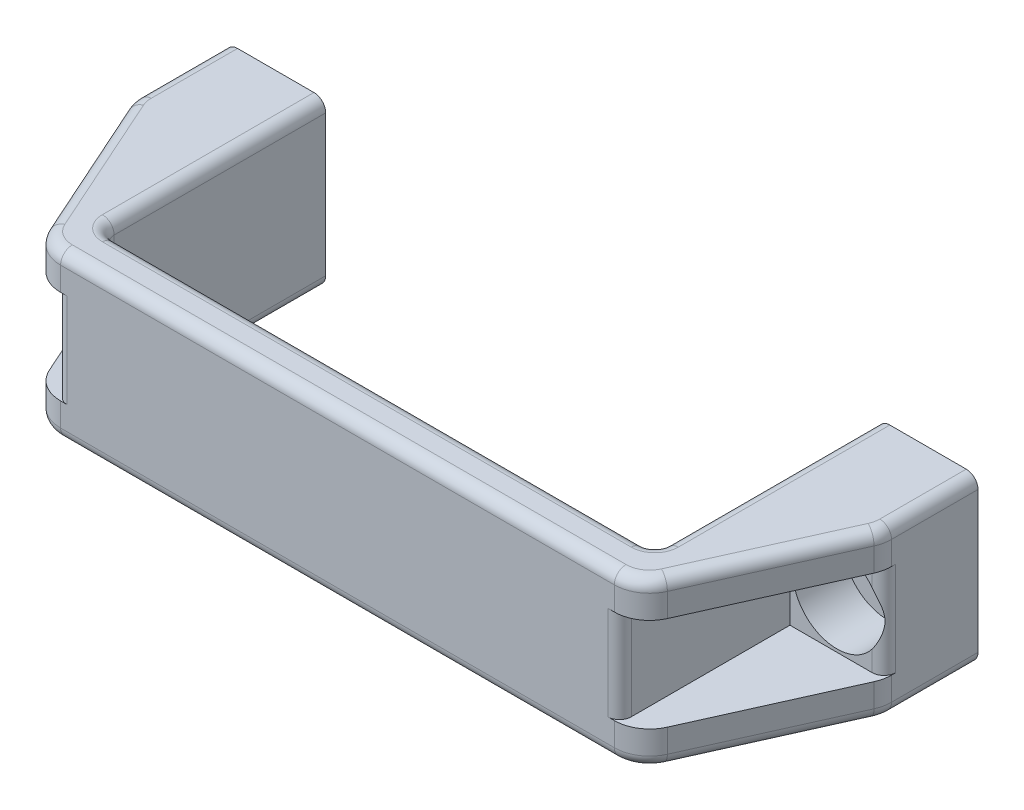
from build123d import *

# Parameters (mm, degrees)
SKETCH1_W                                           = 128
SKETCH1_H                                           = 28
BOSS_EXTRUDE1_DEPTH                                 = 45
SKETCH2_OUTSIDE_W                                   = 157.708
SKETCH2_OUTSIDE_H                                   = 74.708
CUT_EXTRUDE2_DEPTH                                  = 84.096329642
FILLET1_R                                           = 6
FILLET2_R                                           = 2
SKETCH3_W                                           = 16
SKETCH3_H                                           = 16
CUT_EXTRUDE3_DEPTH                                  = 29
FILLET3_R                                           = 2
CBORE_FOR_M8_HEX_SOCKET_HEAD_CAP_SCREW1_D           = 9
CBORE_FOR_M8_HEX_SOCKET_HEAD_CAP_SCREW1_DEPTH       = 15
CBORE_FOR_M8_HEX_SOCKET_HEAD_CAP_SCREW1_CBORE_D     = 15
CBORE_FOR_M8_HEX_SOCKET_HEAD_CAP_SCREW1_CBORE_DEPTH = 8.6
CBORE_FOR_M8_HEX_SOCKET_HEAD_CAP_SCREW1_TIP         = 2.703872786


with BuildPart() as part:
    # Sketch1 → Boss-Extrude1 (new body)
    with BuildSketch(Plane.XY):
        Rectangle(SKETCH1_W, SKETCH1_H)
    extrude(amount=BOSS_EXTRUDE1_DEPTH)

    # Sketch2 outside → Cut-Extrude2 (cut, through all)
    with BuildSketch(Plane.XZ.offset(14)):
        with Locations((0, 22.5)):
            Rectangle(SKETCH2_OUTSIDE_W, SKETCH2_OUTSIDE_H)
        Polygon((-47, 0), (-47, 38), (47, 38), (47, 0), (64, 0), (64, 16), (51, 45), (-51, 45), (-64, 16), (-64, 0), align=None, mode=Mode.SUBTRACT)
    extrude(amount=-CUT_EXTRUDE2_DEPTH, mode=Mode.SUBTRACT)

    # Fillet1
    fillet1_edges = [part.edges().sort_by_distance(p)[0] for p in [
        (-64, 0, 16),
        (-51, 0, 45),
        (51, 0, 45),
        (64, 0, 16),
    ]]
    fillet(fillet1_edges, radius=FILLET1_R)

    # Fillet2
    fillet2_edges = [part.edges().sort_by_distance(p)[0] for p in [
        (-47, 14, 19),
        (0, 14, 38),
        (47, -14, 19),
        (47, 14, 19),
        (47, 0, 38),
        (0, -14, 38),
        (-47, 0, 38),
        (-47, -14, 19),
        (0, -14, 45),
        (0, 14, 45),
        (-58.032245896, -14, 29.312682233),
        (-64, -14, 7.358346808),
        (64, -14, 7.358346808),
        (58.032245896, -14, 29.312682233),
        (63.867296468, -14, 15.971616785),
        (50.375820334, -14, 44.036169802),
        (-63.867296468, -14, 15.971616785),
        (-50.375820334, -14, 44.036169802),
        (-58.032245896, 14, 29.312682233),
        (58.032245896, 14, 29.312682233),
        (64, 14, 7.358346808),
        (-64, 14, 7.358346808),
        (63.867296468, 14, 15.971616785),
        (50.375820334, 14, 44.036169802),
        (-63.867296468, 14, 15.971616785),
        (-50.375820334, 14, 44.036169802),
    ]]
    fillet(fillet2_edges, radius=FILLET2_R)

    # Sketch3 → Cut-Extrude3 (cut)
    with BuildSketch(Plane.XY.offset(45)):
        with Locations((-56, 0)):
            Rectangle(SKETCH3_W, SKETCH3_H)
        with Locations((56, 0)):
            Rectangle(SKETCH3_W, SKETCH3_H)
    extrude(amount=-CUT_EXTRUDE3_DEPTH, mode=Mode.SUBTRACT)

    # Fillet3
    # the kernel refuses this fillet: 2 mm, written as the material it takes off along each edge
    with BuildSketch(Plane(origin=(63.861153873, -8, 16), x_dir=(0.06925637128898768, 0, -0.9975988948650063), z_dir=(0, 1, 0))) as fillet3_piece_1:
        with BuildLine():
            CenterArc((1.866301026, 1.99519779), FILLET3_R, 183.971276773, 90)
            Line((-0.128896764, 1.856685047), (-0.328416543, 1.842833773))
            Line((-0.328416543, 1.842833773), (-0.199519779, -0.013851274))
            Line((-0.199519779, -0.013851274), (-0.029143426, -0.197865259))
            ThreePointArc((-0.029143426, -0.197865259), (1.303692283, -0.249155378), (2.018665043, -0.199519779))
            Line((2.018665043, -0.199519779), (2.004813769, 0))
        make_face()
    extrude(amount=16, mode=Mode.SUBTRACT)
    with BuildSketch(Plane(origin=(48, -8, 44.934279824), x_dir=(-0.999460544146637, 0, 0.032842361274859504), z_dir=(0, 1, 0))) as fillet3_piece_2:
        with BuildLine():
            CenterArc((1.935394771, -1.998921088), FILLET3_R, 88.117932867, 90)
            Line((-0.063526317, -1.933236366), (-0.263418426, -1.926667893))
            Line((-0.263418426, -1.926667893), (-0.199892109, 0.006568472))
            Line((-0.199892109, 0.006568472), (-0.02300822, 0.198672147))
            ThreePointArc((-0.02300822, 0.198672147), (0.893869228, 0.236490976), (2.007647966, 0.199892109))
            Line((2.007647966, 0.199892109), (2.001079494, 0))
        make_face()
    extrude(amount=16, mode=Mode.SUBTRACT)
    with BuildSketch(Plane(origin=(-63.861153873, -8, 16), x_dir=(-0.06925637128898415, 0, -0.9975988948650065), z_dir=(0, 1, 0))) as fillet3_piece_3:
        with BuildLine():
            CenterArc((1.866301026, -1.99519779), FILLET3_R, 86.028723227, 90)
            Line((-0.128896764, -1.856685047), (-0.328416543, -1.842833773))
            Line((-0.328416543, -1.842833773), (-0.199519779, 0.013851274))
            Line((-0.199519779, 0.013851274), (-0.029143426, 0.197865259))
            ThreePointArc((-0.029143426, 0.197865259), (1.303692283, 0.249155378), (2.018665043, 0.199519779))
            Line((2.018665043, 0.199519779), (2.004813769, 0))
        make_face()
    extrude(amount=16, mode=Mode.SUBTRACT)
    with BuildSketch(Plane(origin=(-48, -8, 44.934279824), x_dir=(0.999460544146637, 0, 0.032842361274859504), z_dir=(0, 1, 0))) as fillet3_piece_4:
        with BuildLine():
            CenterArc((1.935394771, 1.998921088), FILLET3_R, 181.882067133, 90)
            Line((-0.063526317, 1.933236366), (-0.263418426, 1.926667893))
            Line((-0.263418426, 1.926667893), (-0.199892109, -0.006568472))
            Line((-0.199892109, -0.006568472), (-0.02300822, -0.198672147))
            ThreePointArc((-0.02300822, -0.198672147), (0.893869228, -0.236490976), (2.007647966, -0.199892109))
            Line((2.007647966, -0.199892109), (2.001079494, 0))
        make_face()
    extrude(amount=16, mode=Mode.SUBTRACT)

    # CBORE for M8 Hex Socket Head Cap Screw1
    with Locations(Plane.XY.offset(16)):
        with Locations((-56, 0), (56, 0)):
            CounterBoreHole(CBORE_FOR_M8_HEX_SOCKET_HEAD_CAP_SCREW1_D / 2, CBORE_FOR_M8_HEX_SOCKET_HEAD_CAP_SCREW1_CBORE_D / 2, CBORE_FOR_M8_HEX_SOCKET_HEAD_CAP_SCREW1_CBORE_DEPTH, depth=CBORE_FOR_M8_HEX_SOCKET_HEAD_CAP_SCREW1_DEPTH)
            with Locations((0, 0, -(CBORE_FOR_M8_HEX_SOCKET_HEAD_CAP_SCREW1_DEPTH + CBORE_FOR_M8_HEX_SOCKET_HEAD_CAP_SCREW1_TIP / 2))):  # 118° drill point
                Cone(0, CBORE_FOR_M8_HEX_SOCKET_HEAD_CAP_SCREW1_D / 2, CBORE_FOR_M8_HEX_SOCKET_HEAD_CAP_SCREW1_TIP, mode=Mode.SUBTRACT)


solid = part.part
